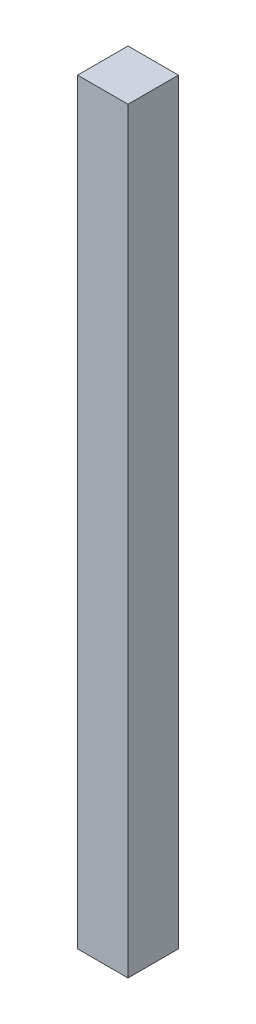
from build123d import *

# Parameters (mm, degrees)
SKETCH1_W           = 10
SKETCH1_H           = 10
BOSS_EXTRUDE1_DEPTH = 150


with BuildPart() as part:
    # Sketch1 → Boss-Extrude1 (new body)
    with BuildSketch(Plane(origin=(0, 0, 0), x_dir=(1, 0, 0), z_dir=(0, 1, 0))):
        with Locations((5, 5)):
            Rectangle(SKETCH1_W, SKETCH1_H)
    extrude(amount=BOSS_EXTRUDE1_DEPTH)


solid = part.part
